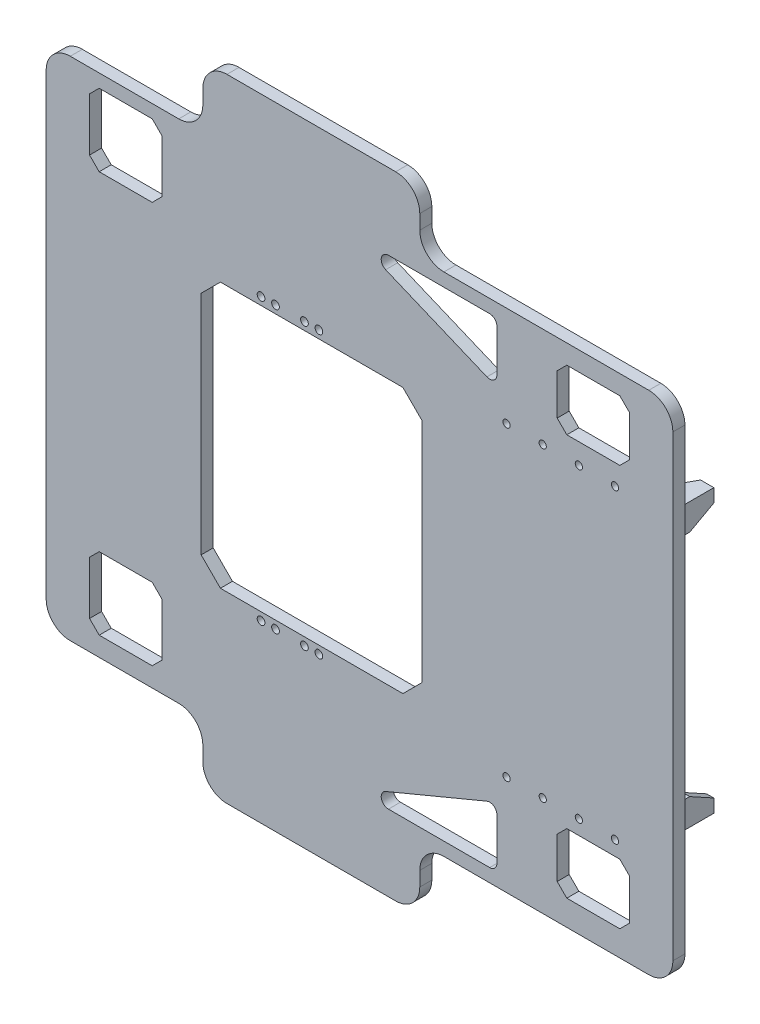
from build123d import *

# Parameters (mm, degrees)
EXTRUDE_1_DEPTH       = 5
CUT_EXTRUDE_1_DEPTH   = 185.623942109
CUT_EXTRUDE_2_DEPTH   = 185.623942109
EXTRUDE_2_DEPTH       = 20
CUT_EXTRUDE_3_DEPTH   = 10
CUT_EXTRUDE_4_DEPTH   = 10
MIRROR_2_COPY_1_DEPTH = 20
MIRROR_2_COPY_2_DEPTH = 10
MIRROR_2_COPY_3_DEPTH = 10
MIRROR_2_COPY_4_DEPTH = 20
MIRROR_2_COPY_5_DEPTH = 10
MIRROR_2_COPY_6_DEPTH = 10
SKETCH_7_R            = 1.6
CUT_EXTRUDE_5_DEPTH   = 186.636742053
SKETCH_8_R            = 1.5
CUT_EXTRUDE_6_DEPTH   = 186.636742053


with BuildPart() as part:
    # 草图1 → 凸台-拉伸1 (new body)
    with BuildSketch(Plane.XY):
        with BuildLine():
            Line((-130, 95), (-130, -95))
            ThreePointArc((-130, -95), (-127.071067812, -102.071067812), (-120, -105))
            Line((-120, -105), (-75, -105))
            ThreePointArc((-75, -105), (-67.928932188, -107.928932188), (-65, -115))
            Line((-65, -115), (-65, -121))
            ThreePointArc((-65, -121), (-62.071067812, -128.071067812), (-55, -131))
            Line((-55, -131), (15, -131))
            ThreePointArc((15, -131), (22.071067812, -128.071067812), (25, -121))
            Line((25, -121), (25, -115))
            ThreePointArc((25, -115), (27.928932188, -107.928932188), (35, -105))
            Line((35, -105), (120, -105))
            ThreePointArc((120, -105), (127.071067812, -102.071067812), (130, -95))
            Line((130, -95), (130, 95))
            ThreePointArc((130, 95), (127.071067812, 102.071067812), (120, 105))
            Line((120, 105), (35, 105))
            ThreePointArc((35, 105), (27.928932188, 107.928932188), (25, 115))
            Line((25, 115), (25, 121))
            ThreePointArc((25, 121), (22.071067812, 128.071067812), (15, 131))
            Line((15, 131), (-55, 131))
            ThreePointArc((-55, 131), (-62.071067812, 128.071067812), (-65, 121))
            Line((-65, 121), (-65, 115))
            ThreePointArc((-65, 115), (-67.928932188, 107.928932188), (-75, 105))
            Line((-75, 105), (-120, 105))
            ThreePointArc((-120, 105), (-127.071067812, 102.071067812), (-130, 95))
        make_face()
    extrude(amount=EXTRUDE_1_DEPTH)

    # 草图2 → 切除-拉伸1 (cut, through all)
    with BuildSketch(Plane.XY.offset(5)):
        with BuildLine():
            Line((10.846153846, -93.730769231), (52.846153846, -76.230769231))
            ThreePointArc((52.846153846, -76.230769231), (55.664100589, -76.503849117), (57, -79))
            Line((57, -79), (57, -96.5))
            ThreePointArc((57, -96.5), (56.121320344, -98.621320344), (54, -99.5))
            Line((54, -99.5), (12, -99.5))
            ThreePointArc((12, -99.5), (9.058257973, -97.088348405), (10.846153846, -93.730769231))
        make_face()
        Polygon((-108, 99.5), (-86, 99.5), (-82, 95.5), (-82, 73.5), (-86, 69.5), (-108, 69.5), (-112, 73.5), (-112, 95.5), align=None)
        Polygon((-108, -67), (-86, -67), (-82, -71), (-82, -93), (-86, -97), (-108, -97), (-112, -93), (-112, -71), align=None)
        Polygon((86, 97), (108, 97), (112, 93), (112, 76), (108, 72), (86, 72), (82, 76), (82, 93), align=None)
        Polygon((86, -69.5), (108, -69.5), (112, -73.5), (112, -90.5), (108, -94.5), (86, -94.5), (82, -90.5), (82, -73.5), align=None)
        with BuildLine():
            Line((12, 99.5), (54, 99.5))
            ThreePointArc((54, 99.5), (56.121320344, 98.621320344), (57, 96.5))
            Line((57, 96.5), (57, 79))
            ThreePointArc((57, 79), (55.664100589, 76.503849117), (52.846153846, 76.230769231))
            Line((52.846153846, 76.230769231), (10.846153846, 93.730769231))
            ThreePointArc((10.846153846, 93.730769231), (9.058257973, 97.088348405), (12, 99.5))
        make_face()
    extrude(amount=-CUT_EXTRUDE_1_DEPTH, mode=Mode.SUBTRACT)

    # 草图3 → 切除-拉伸2 (cut, through all)
    with BuildSketch(Plane(origin=(0, 0, 0), x_dir=(-1, 0, 0), z_dir=(0, 0, -1))):
        Polygon((57.7, 55), (-18, 55), (-26, 47), (-26, -47), (-18, -55), (57.7, -55), (65.7, -47), (65.7, 47), align=None)
    extrude(amount=-CUT_EXTRUDE_2_DEPTH, mode=Mode.SUBTRACT)

    # 草图4 → 凸台-拉伸2 (add)
    with BuildSketch(Plane(origin=(0, 0, 0), x_dir=(-1, 0, 0), z_dir=(0, 0, -1))):
        Polygon((-46, -47.5), (-46, -58.5), (-57, -58.5), (-57, -55.5), (-49, -55.5), (-49, -47.5), align=None)
    extrude_2 = extrude(amount=EXTRUDE_2_DEPTH)

    # 草图5 → 切除-拉伸3 (cut)
    with BuildSketch(Plane.XZ.offset(58.5)):
        Polygon((57, -10), (51.5, -20), (57, -20), align=None)
    cut_extrude_3 = extrude(amount=-CUT_EXTRUDE_3_DEPTH, mode=Mode.SUBTRACT)

    # 草图6 → 切除-拉伸4 (cut)
    with BuildSketch(Plane.ZY.offset(-46)):
        Polygon((-20, -53), (-10, -47.5), (-20, -47.5), align=None)
    cut_extrude_4 = extrude(amount=-CUT_EXTRUDE_4_DEPTH, mode=Mode.SUBTRACT)

    # 镜向1: 凸台-拉伸2, 切除-拉伸3, 切除-拉伸4 across plane
    add(extrude_2.mirror(Plane(origin=(84, 0, 0), x_dir=(0, 0, 1), z_dir=(1, 0, 0))))
    add(cut_extrude_3.mirror(Plane(origin=(84, 0, 0), x_dir=(0, 0, 1), z_dir=(1, 0, 0))), mode=Mode.SUBTRACT)
    add(cut_extrude_4.mirror(Plane(origin=(84, 0, 0), x_dir=(0, 0, 1), z_dir=(1, 0, 0))), mode=Mode.SUBTRACT)

    # 镜向2 copy 1 sketch → 镜向2 copy 1 (add)
    with BuildSketch(Plane(origin=(168, 0, 0), x_dir=(1, 0, 0), z_dir=(0, 0, -1))):
        Polygon((-46, -47.5), (-46, -58.5), (-57, -58.5), (-57, -55.5), (-49, -55.5), (-49, -47.5), align=None)
    extrude(amount=MIRROR_2_COPY_1_DEPTH)

    # 镜向2 copy 2 sketch → 镜向2 copy 2 (cut)
    with BuildSketch(Plane(origin=(168, 58.5, 0), x_dir=(-1, 0, 0), z_dir=(0, 1, 0))):
        Polygon((57, -10), (51.5, -20), (57, -20), align=None)
    extrude(amount=-MIRROR_2_COPY_2_DEPTH, mode=Mode.SUBTRACT)

    # 镜向2 copy 3 sketch → 镜向2 copy 3 (cut)
    with BuildSketch(Plane(origin=(122, 0, 0), x_dir=(0, 0, 1), z_dir=(1, 0, 0))):
        Polygon((-20, -53), (-10, -47.5), (-20, -47.5), align=None)
    extrude(amount=-MIRROR_2_COPY_3_DEPTH, mode=Mode.SUBTRACT)

    # 镜向2 copy 4 sketch → 镜向2 copy 4 (add)
    with BuildSketch(Plane(origin=(0, 0, 0), x_dir=(-1, 0, 0), z_dir=(0, 0, -1))):
        Polygon((-46, 47.5), (-46, 58.5), (-57, 58.5), (-57, 55.5), (-49, 55.5), (-49, 47.5), align=None)
    extrude(amount=MIRROR_2_COPY_4_DEPTH)

    # 镜向2 copy 5 sketch → 镜向2 copy 5 (cut)
    with BuildSketch(Plane(origin=(0, 58.5, 0), x_dir=(1, 0, 0), z_dir=(0, 1, 0))):
        Polygon((57, 10), (51.5, 20), (57, 20), align=None)
    extrude(amount=-MIRROR_2_COPY_5_DEPTH, mode=Mode.SUBTRACT)

    # 镜向2 copy 6 sketch → 镜向2 copy 6 (cut)
    with BuildSketch(Plane.ZY.offset(-46)):
        Polygon((-20, 53), (-10, 47.5), (-20, 47.5), align=None)
    extrude(amount=-MIRROR_2_COPY_6_DEPTH, mode=Mode.SUBTRACT)

    # 草图7 → 切除-拉伸5 (cut, through all)
    with BuildSketch(Plane(origin=(0, 0, 0), x_dir=(-1, 0, 0), z_dir=(0, 0, -1))):
        with Locations((16.85, -58.25)):
            Circle(SKETCH_7_R)
        with Locations((22.85, -58.25)):
            Circle(SKETCH_7_R)
        with Locations((40.85, -58.25)):
            Circle(SKETCH_7_R)
        with Locations((34.85, -58.25)):
            Circle(SKETCH_7_R)
    cut_extrude_5 = extrude(amount=-CUT_EXTRUDE_5_DEPTH, mode=Mode.SUBTRACT)

    # 镜向3: 切除-拉伸5 across plane
    add(cut_extrude_5.mirror(Plane.ZX), mode=Mode.SUBTRACT)

    # 草图8 → 切除-拉伸6 (cut, through all)
    with BuildSketch(Plane(origin=(0, 0, 0), x_dir=(-1, 0, 0), z_dir=(0, 0, -1))):
        with Locations((-61, -63.5)):
            Circle(SKETCH_8_R)
        with Locations((-76, -63.5)):
            Circle(SKETCH_8_R)
        with Locations((-91, -63.5)):
            Circle(SKETCH_8_R)
        with Locations((-106, -63.5)):
            Circle(SKETCH_8_R)
        with Locations((-106, 63.5)):
            Circle(SKETCH_8_R)
        with Locations((-91, 63.5)):
            Circle(SKETCH_8_R)
        with Locations((-76, 63.5)):
            Circle(SKETCH_8_R)
        with Locations((-61, 63.5)):
            Circle(SKETCH_8_R)
    extrude(amount=-CUT_EXTRUDE_6_DEPTH, mode=Mode.SUBTRACT)


solid = part.part
